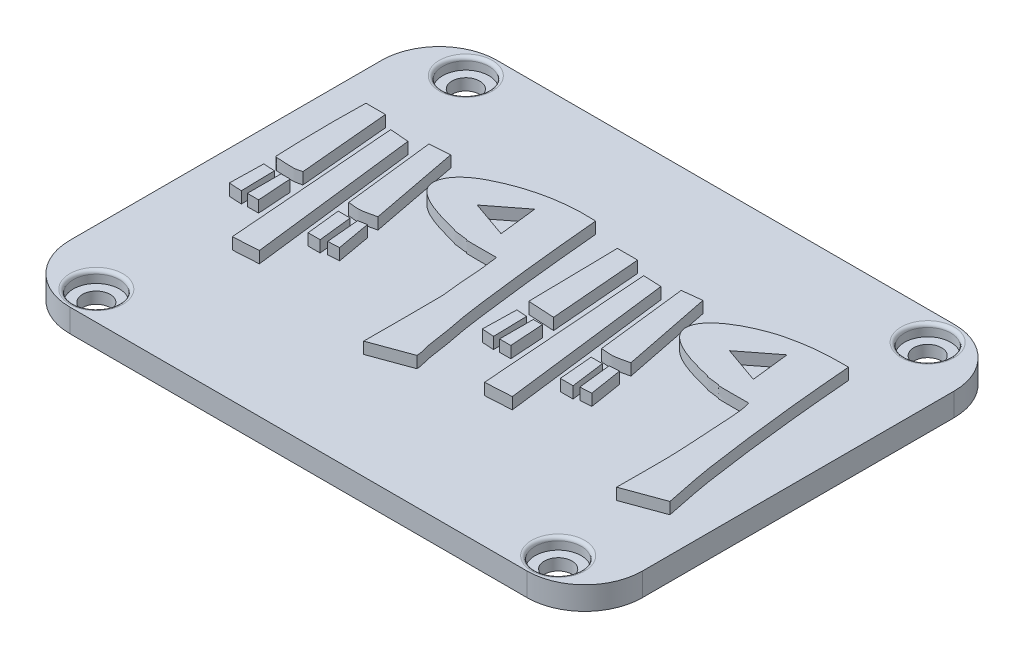
from build123d import *

# Parameters (mm, degrees)
SKETCH_1_W          = 49.6
SKETCH_1_H          = 37
EXTRUDE_1_DEPTH     = 2
FILLET_1_R          = 5
CUT_EXTRUDE_1_REACH = 33.005
SKETCH_2_R          = 1.2
SKETCH_3_R          = 2
CUT_EXTRUDE_2_DEPTH = 1
FILLET_2_R          = 0.3
EXTRUDE_2_DEPTH     = 1


with BuildPart() as part:
    # 草图1 → 凸台-拉伸1 (new body)
    with BuildSketch(Plane(origin=(0, 0, 0), x_dir=(1, 0, 0), z_dir=(0, 1, 0))):
        Rectangle(SKETCH_1_W, SKETCH_1_H)
    extrude(amount=EXTRUDE_1_DEPTH)

    # 圆角1
    fillet_1_edges = [part.edges().sort_by_distance(p)[0] for p in [
        (-24.8, 1, 18.5),
        (24.8, 1, 18.5),
        (24.8, 1, -18.5),
        (-24.8, 1, -18.5),
    ]]
    fillet(fillet_1_edges, radius=FILLET_1_R)

    # 草图2 → 切除-拉伸1 (cut, up to next)
    with BuildSketch(Plane(origin=(0, 2, 0), x_dir=(1, 0, 0), z_dir=(0, 1, 0)), mode=Mode.PRIVATE) as cut_extrude_1_sk1:
        with Locations((-20, 16)):
            Circle(SKETCH_2_R)
    cut_extrude_1_tool1 = extrude(cut_extrude_1_sk1.sketch, amount=-CUT_EXTRUDE_1_REACH, mode=Mode.PRIVATE) & part.part
    # 草图2 → 切除-拉伸1 (cut, up to next)
    with BuildSketch(Plane(origin=(0, 2, 0), x_dir=(1, 0, 0), z_dir=(0, 1, 0)), mode=Mode.PRIVATE) as cut_extrude_1_sk2:
        with Locations((-20, -16)):
            Circle(SKETCH_2_R)
    cut_extrude_1_tool2 = extrude(cut_extrude_1_sk2.sketch, amount=-CUT_EXTRUDE_1_REACH, mode=Mode.PRIVATE) & part.part
    # 草图2 → 切除-拉伸1 (cut, up to next)
    with BuildSketch(Plane(origin=(0, 2, 0), x_dir=(1, 0, 0), z_dir=(0, 1, 0)), mode=Mode.PRIVATE) as cut_extrude_1_sk3:
        with Locations((20, -16)):
            Circle(SKETCH_2_R)
    cut_extrude_1_tool3 = extrude(cut_extrude_1_sk3.sketch, amount=-CUT_EXTRUDE_1_REACH, mode=Mode.PRIVATE) & part.part
    # 草图2 → 切除-拉伸1 (cut, up to next)
    with BuildSketch(Plane(origin=(0, 2, 0), x_dir=(1, 0, 0), z_dir=(0, 1, 0)), mode=Mode.PRIVATE) as cut_extrude_1_sk4:
        with Locations((20, 16)):
            Circle(SKETCH_2_R)
    cut_extrude_1_tool4 = extrude(cut_extrude_1_sk4.sketch, amount=-CUT_EXTRUDE_1_REACH, mode=Mode.PRIVATE) & part.part
    add(cut_extrude_1_tool1.solids().sort_by_distance((-20, 2, -16))[0], mode=Mode.SUBTRACT)
    add(cut_extrude_1_tool2.solids().sort_by_distance((-20, 2, 16))[0], mode=Mode.SUBTRACT)
    add(cut_extrude_1_tool3.solids().sort_by_distance((20, 2, 16))[0], mode=Mode.SUBTRACT)
    add(cut_extrude_1_tool4.solids().sort_by_distance((20, 2, -16))[0], mode=Mode.SUBTRACT)

    # 草图3 → 切除-拉伸2 (cut)
    with BuildSketch(Plane(origin=(0, 2, 0), x_dir=(1, 0, 0), z_dir=(0, 1, 0))):
        with Locations((-20, 16)):
            Circle(SKETCH_3_R)
        with Locations((20, 16)):
            Circle(SKETCH_3_R)
        with Locations((20, -16)):
            Circle(SKETCH_3_R)
        with Locations((-20, -16)):
            Circle(SKETCH_3_R)
    extrude(amount=-CUT_EXTRUDE_2_DEPTH, mode=Mode.SUBTRACT)

    # 圆角2
    fillet_2_edges = [part.edges().sort_by_distance(p)[0] for p in [
        (-22, 2, -16),
        (18, 2, 16),
        (18, 2, -16),
        (-22, 2, 16),
    ]]
    fillet(fillet_2_edges, radius=FILLET_2_R)

    # 草图4 → 凸台-拉伸2 (add)
    # profile 1 of 16: a face of its own
    with BuildSketch(Plane(origin=(0, 2, 0), x_dir=(1, 0, 0), z_dir=(0, 1, 0))):
        with BuildLine():
            Line((21.772779449, -8.095391306), (18.392470655, -9.330504134))
            add(Edge.make_bspline(
                [(18.392470655, -9.330504134), (18.392470655, -7.271868711), (18.455878866, -5.209566383), (18.327464716, -3.154939991), (18.284127424, -2.461543315), (18.256785252, -1.766961446), (18.19745284, -1.074749964), (18.117883761, -0.146444045), (18.129446344, 1.729507058), (17.807417209, 2.695594461)],
                knots=[0, 0, 0, 0, 1, 1, 1, 2, 2, 2, 3, 3, 3, 3], degree=3))
            add(Edge.make_bspline(
                [(17.807417209, 2.695594461), (16.940671365, 2.695594461), (16.073667828, 2.674460603), (15.207179675, 2.695594461), (15.176544693, 2.696341655), (15.172400884, 2.755562541), (15.142173737, 2.760600399), (14.776312856, 2.821577212), (14.402933666, 2.829635462), (14.037072785, 2.890612276), (14.006845638, 2.895650134), (14.001795984, 2.94818593), (13.972066847, 2.955618214), (12.87353701, 3.230250673), (9.335911632, 3.97107703), (9.421651162, 5.685867625), (9.510559325, 7.464030884), (12.920686217, 8.866721722), (14.362102477, 9.196188296), (14.90065745, 9.319286575), (15.441480477, 9.435606935), (15.987250936, 9.521217987), (17.123631614, 9.69947378), (18.282289105, 9.716235802), (19.432565668, 9.716235802)],
                knots=[0, 0, 0, 0, 1, 1, 1, 2, 2, 2, 3, 3, 3, 4, 4, 4, 5, 5, 5, 6, 6, 6, 7, 7, 7, 8, 8, 8, 8], degree=3))
            add(Edge.make_bspline(
                [(19.432565668, 9.716235802), (19.806886753, 5.074654356), (20.299015723, 0.513347145), (20.992708189, -4.065023128), (21.168371545, -5.224401279), (21.555088387, -6.93437231), (21.772779449, -8.095391306)],
                knots=[0, 0, 0, 0, 1, 1, 1, 2, 2, 2, 2], degree=3))
        make_face()
        Polygon((16.227936537, 4.674916894), (15.846361476, 7.972815636), (13.042065388, 5.791333279), align=None, mode=Mode.SUBTRACT)
    # profile 2 of 16: a face of its own
    with BuildSketch(Plane(origin=(0, 2, 0), x_dir=(1, 0, 0), z_dir=(0, 1, 0))):
        with BuildLine():
            Line((-0.134221775, -8.095391306), (-3.51453057, -9.330504134))
            add(Edge.make_bspline(
                [(-3.51453057, -9.330504134), (-3.51453057, -7.098633584), (-3.493071268, -4.866659867), (-3.51453057, -2.634892484), (-3.518893044, -2.181195119), (-3.66805424, -1.168812691), (-3.709548385, -0.684714334), (-3.774554323, 0.073688281), (-3.779428406, 0.839666745), (-3.9045662, 1.590493509), (-3.965543013, 1.956354389), (-3.991240784, 2.327227477), (-4.034578076, 2.695594461)],
                knots=[0, 0, 0, 0, 1, 1, 1, 2, 2, 2, 3, 3, 3, 4, 4, 4, 4], degree=3))
            add(Edge.make_bspline(
                [(-4.034578076, 2.695594461), (-4.901323921, 2.695594461), (-5.768327457, 2.674460603), (-6.63481561, 2.695594461), (-6.665450593, 2.696341655), (-6.669552448, 2.755821067), (-6.699821549, 2.760600399), (-7.087455169, 2.821805708), (-7.482294818, 2.829406967), (-7.869928439, 2.890612276), (-7.900197539, 2.895391607), (-7.905370065, 2.94755522), (-7.934934377, 2.955618214), (-9.074310116, 3.266357052), (-12.329170549, 3.940899047), (-12.420344124, 5.49084981), (-12.486172717, 6.609935897), (-11.292516664, 7.548273989), (-10.405160035, 8.026081405), (-8.004942131, 9.31850643), (-5.186345635, 9.875759925), (-2.474435556, 9.716235802)],
                knots=[0, 0, 0, 0, 1, 1, 1, 2, 2, 2, 3, 3, 3, 4, 4, 4, 5, 5, 5, 6, 6, 6, 7, 7, 7, 7], degree=3))
            add(Edge.make_bspline(
                [(-2.474435556, 9.716235802), (-2.101496817, 5.55175322), (-1.681377293, 1.548991842), (-1.109310851, -2.569886546), (-1.030641335, -3.136307059), (-0.824660278, -4.135464695), (-0.71927522, -4.715082511), (-0.59373164, -5.405572203), (-0.519789109, -6.104782846), (-0.394245529, -6.795272539), (-0.329309304, -7.152421774), (-0.134221775, -7.684510904), (-0.134221775, -8.095391306)],
                knots=[0, 0, 0, 0, 1, 1, 1, 2, 2, 2, 3, 3, 3, 4, 4, 4, 4], degree=3))
        make_face()
        Polygon((-5.622033199, 4.674916894), (-6.00360826, 7.972815636), (-8.807904349, 5.791333279), align=None, mode=Mode.SUBTRACT)
    # profile 3 of 16: a face of its own
    with BuildSketch(Plane(origin=(0, 2, 0), x_dir=(1, 0, 0), z_dir=(0, 1, 0))):
        Polygon((7.081437382, -7.055296292), (4.806229539, -7.185308169), (3.701128587, 7.701051714), (5.261271108, 7.636045775), align=None)
    # profile 4 of 16: a face of its own
    with BuildSketch(Plane(origin=(0, 2, 0), x_dir=(1, 0, 0), z_dir=(0, 1, 0))):
        Polygon((-14.825563842, -7.055296292), (-17.035765746, -7.185308169), (-18.205872637, 7.701051714), (-16.580724178, 7.571039837), align=None)
    # profile 5 of 16: a face of its own
    with BuildSketch(Plane(origin=(0, 2, 0), x_dir=(1, 0, 0), z_dir=(0, 1, 0))):
        Polygon((8.901603655, -3.609981559), (7.796502703, -3.609981559), (7.53647895, -0.684714334), (8.511568025, -0.684714334), align=None)
    # profile 6 of 16: a face of its own
    with BuildSketch(Plane(origin=(0, 2, 0), x_dir=(1, 0, 0), z_dir=(0, 1, 0))):
        Polygon((-13.005397569, -3.609981559), (-14.045492582, -3.609981559), (-14.370522274, -0.684714334), (-13.33042726, -0.684714334), align=None)
    # profile 7 of 16: a face of its own
    with BuildSketch(Plane(origin=(0, 2, 0), x_dir=(1, 0, 0), z_dir=(0, 1, 0))):
        Polygon((9.291639286, -3.414963744), (8.966609594, -0.554702457), (9.811686792, -0.489696519), (10.266728361, -3.349957806), align=None)
    # profile 8 of 16: a face of its own
    with BuildSketch(Plane(origin=(0, 2, 0), x_dir=(1, 0, 0), z_dir=(0, 1, 0))):
        Polygon((-12.550356, -3.414963744), (-12.810379754, -0.554702457), (-12.095314432, -0.42469058), (-11.575266925, -3.349957806), align=None)
    # profile 9 of 16: a face of its own
    with BuildSketch(Plane(origin=(0, 2, 0), x_dir=(1, 0, 0), z_dir=(0, 1, 0))):
        Polygon((2.205992005, -3.284951868), (2.205992005, -0.359684642), (2.986063266, -0.359684642), (3.181081081, -3.284951868), align=None)
    # profile 10 of 16: a face of its own
    with BuildSketch(Plane(origin=(0, 2, 0), x_dir=(1, 0, 0), z_dir=(0, 1, 0))):
        Polygon((1.750950437, -3.349957806), (0.710855423, -3.284951868), (0.775861362, -0.359684642), (1.685944499, -0.42469058), align=None)
    # profile 11 of 16: a face of its own
    with BuildSketch(Plane(origin=(0, 2, 0), x_dir=(1, 0, 0), z_dir=(0, 1, 0))):
        Polygon((-19.63600328, -3.284951868), (-19.63600328, -0.359684642), (-18.85593202, -0.359684642), (-18.660914205, -3.284951868), align=None)
    # profile 12 of 16: a face of its own
    with BuildSketch(Plane(origin=(0, 2, 0), x_dir=(1, 0, 0), z_dir=(0, 1, 0))):
        Polygon((-20.091044849, -3.349957806), (-21.196145801, -3.284951868), (-21.131139862, -0.359684642), (-20.156050787, -0.42469058), align=None)
    # profile 13 of 16: a face of its own
    with BuildSketch(Plane(origin=(0, 2, 0), x_dir=(1, 0, 0), z_dir=(0, 1, 0))):
        with BuildLine():
            Line((7.341461135, 0.420386618), (6.431377998, 8.22109922))
            Line((6.431377998, 8.22109922), (8.121532395, 8.416117035))
            Line((8.121532395, 8.416117035), (9.681674916, 0.615404433))
            add(Edge.make_bspline(
                [(9.681674916, 0.615404433), (9.248301993, 0.528729849), (8.821984925, 0.392083078), (8.381556149, 0.35538068), (8.035381242, 0.326532771), (7.688159473, 0.398717972), (7.341461135, 0.420386618)],
                knots=[0, 0, 0, 0, 1, 1, 1, 2, 2, 2, 2], degree=3))
        make_face()
    # profile 14 of 16: a face of its own
    with BuildSketch(Plane(origin=(0, 2, 0), x_dir=(1, 0, 0), z_dir=(0, 1, 0))):
        with BuildLine():
            Line((-14.565540089, 0.420386618), (-15.475623226, 8.286105159))
            Line((-15.475623226, 8.286105159), (-13.720462891, 8.416117035))
            Line((-13.720462891, 8.416117035), (-12.225326308, 0.615404433))
            add(Edge.make_bspline(
                [(-12.225326308, 0.615404433), (-12.658699231, 0.528729849), (-13.085016299, 0.392083078), (-13.525445075, 0.35538068), (-13.871619982, 0.326532771), (-14.218841751, 0.398717972), (-14.565540089, 0.420386618)],
                knots=[0, 0, 0, 0, 1, 1, 1, 2, 2, 2, 2], degree=3))
        make_face()
    # profile 15 of 16: a face of its own
    with BuildSketch(Plane(origin=(0, 2, 0), x_dir=(1, 0, 0), z_dir=(0, 1, 0))):
        Polygon((2.921057327, 0.680410372), (0.645849485, 0.810422248), (0.515837608, 8.611134851), (2.270997944, 8.611134851), align=None)
    # profile 16 of 16: a face of its own
    with BuildSketch(Plane(origin=(0, 2, 0), x_dir=(1, 0, 0), z_dir=(0, 1, 0))):
        with BuildLine():
            Line((-21.261151739, 8.611134851), (-19.570997342, 8.611134851))
            Line((-19.570997342, 8.611134851), (-18.85593202, 0.74541631))
            add(Edge.make_bspline(
                [(-18.85593202, 0.74541631), (-19.094898602, 0.705588546), (-19.328734514, 0.615404433), (-19.570997342, 0.615404433), (-20.069847038, 0.615404433), (-20.569007376, 0.638983159), (-21.066133924, 0.680410372), (-21.127210406, 0.685500079), (-21.19403367, 0.749170467), (-21.196145801, 0.810422248), (-21.285759015, 3.409205471), (-21.337598911, 6.011931012), (-21.261151739, 8.611134851)],
                knots=[0, 0, 0, 0, 1, 1, 1, 2, 2, 2, 3, 3, 3, 4, 4, 4, 4], degree=3))
        make_face()
    extrude(amount=EXTRUDE_2_DEPTH)


solid = part.part
